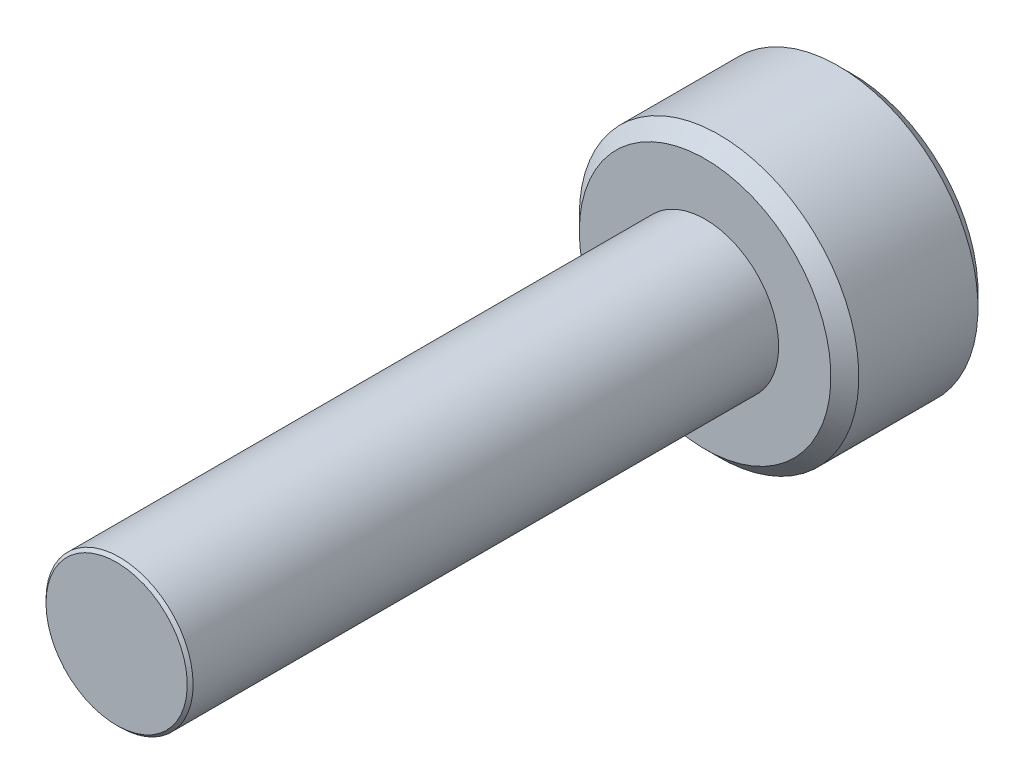
from build123d import *

# Parameters (mm, degrees)
SKETCH1_R            = 1
EXTRUDE1_DEPTH       = 8
CUT_SWEEP1_PITCH     = 0.4
SKETCH6_R            = 1.9
EXTRUDE2_DEPTH       = 2
CUT_EXTRUDE1_DEPTH   = 1.125
CHAMFER1_SIZE        = 0.19
SKETCH10_R           = 1
PARTIAL_THREAD_DEPTH = 8
CHAMFER2_SIZE        = 0.04


with BuildPart() as part:
    # Sketch1 → Extrude1 (new body)
    with BuildSketch(Plane.XY):
        Circle(SKETCH1_R)
    extrude(amount=-EXTRUDE1_DEPTH)

    # Cut-Sweep1: the profile of Sketch3 profile screwed along a right-hand helix of 21 turns, 6 arcs to a turn; built about Z, then put on its axis
    cut_sweep1_z = Axis((0, 0, 0), (0, 0, 1))
    cut_sweep1_corners = [(1.0003, 0, -0.350173205), (0.740192379, 0, -0.2), (0.740192379, 0, -0.15), (1.0003, 0, 0.000173205)]
    with BuildLine(mode=Mode.PRIVATE) as cut_sweep1_profile:
        Line(cut_sweep1_corners[0], cut_sweep1_corners[1])
        Line(cut_sweep1_corners[1], cut_sweep1_corners[2])
        Line(cut_sweep1_corners[2], cut_sweep1_corners[3])
        Line(cut_sweep1_corners[3], cut_sweep1_corners[0])
    cut_sweep1_cap = Face(cut_sweep1_profile.wire())
    cut_sweep1_turn_angles = [0, 30, 60, 90, 120, 150, 180, 210, 240, 270, 300, 330, 360]
    cut_sweep1_turn_weights = [1, 0.8660254037844387, 1, 0.8660254037844387, 1, 0.8660254037844387, 1, 0.8660254037844387, 1, 0.8660254037844387, 1, 0.8660254037844387, 1]
    cut_sweep1_turn_rails = [Edge.make_bspline([Vector(p[0], p[1], 0).rotate(cut_sweep1_z, cut_sweep1_turn_angles[k]) / cut_sweep1_turn_weights[k] + Vector(0, 0, p[2] + CUT_SWEEP1_PITCH * cut_sweep1_turn_angles[k] / 360) for k in range(13)], [0, 0, 0, 1, 1, 2, 2, 3, 3, 4, 4, 5, 5, 6, 6, 6], 2, cut_sweep1_turn_weights) for p in cut_sweep1_corners]
    cut_sweep1_turn_sides = [Face.make_surface_from_curves(cut_sweep1_turn_rails[p[0]], cut_sweep1_turn_rails[p[1]]) for p in [(0, 1), (1, 2), (2, 3), (3, 0)]]
    cut_sweep1 = Plane(origin=(0, 0, 0), x_dir=(0, 1, 0), z_dir=(0, 0, -1)) * Solid(Shell([*[p.moved(Location((0, 0, CUT_SWEEP1_PITCH * i))) for i in range(21) for p in cut_sweep1_turn_sides], cut_sweep1_cap, cut_sweep1_cap.rotate(cut_sweep1_z, 7560).moved(Location((0, 0, CUT_SWEEP1_PITCH * 7560 / 360)))]))
    add(cut_sweep1, mode=Mode.SUBTRACT)

    # Sketch4 → Cut-Revolve1 (revolve, cut)
    with BuildSketch(Plane(origin=(0, 0, 0), x_dir=(0, 0, -1), z_dir=(1, 0, 0)), mode=Mode.PRIVATE) as cut_revolve1_sk:
        Polygon((0.35977197, 1), (0, 0.486192379), (0, 1), align=None)
    revolve(cut_revolve1_sk.sketch.rotate(Axis((0, 0, 0), (0, 0, -1)), 278.428757719), axis=Axis((0, 0, 0), (0, 0, -1)), mode=Mode.SUBTRACT)

    # Sketch6 → Extrude2 (add)
    with BuildSketch(Plane(origin=(0, 0, -8), x_dir=(-1, 0, 0), z_dir=(0, 0, -1))):
        Circle(SKETCH6_R)
    extrude(amount=EXTRUDE2_DEPTH)

    # Sketch7 → Cut-Extrude1 (cut)
    with BuildSketch(Plane(origin=(0, 0, -10), x_dir=(-1, 0, 0), z_dir=(0, 0, -1))):
        Polygon((0, 0.866025404), (-0.75, 0.433012702), (-0.75, -0.433012702), (0, -0.866025404), (0.75, -0.433012702), (0.75, 0.433012702), align=None)
    extrude(amount=-CUT_EXTRUDE1_DEPTH, mode=Mode.SUBTRACT)

    # Cut-Extrude2 cone 1 section (through the dimple's axis) → Cut-Extrude2 (revolve, cut)
    with BuildSketch(Plane(origin=(0, 0, -10), x_dir=(0, 1, 0), z_dir=(1, 0, 0))):
        Polygon((0, 0), (0.866025404, 0), (0, 0.866025404), align=None)
    revolve(axis=Axis((0, 0, -10), (0, 0, 1)), mode=Mode.SUBTRACT)

    # Chamfer1
    chamfer1_edges = [part.edges().sort_by_distance(p)[0] for p in [
        (1.9, 0, -8),
        (1.9, 0, -10),
    ]]
    chamfer(chamfer1_edges, length=CHAMFER1_SIZE)


with BuildPart() as body_2:
    # Sketch10 → partial thread (new body)
    with BuildSketch(Plane.XY.offset(-8)):
        Circle(SKETCH10_R)
    extrude(amount=PARTIAL_THREAD_DEPTH)

    # Chamfer2
    chamfer2_edges = [body_2.edges().sort_by_distance(p)[0] for p in [
        (-1, 0, 0),
    ]]
    chamfer(chamfer2_edges, length=CHAMFER2_SIZE)


with BuildPart() as part_1:
    add(part.part)

    # Combine1: union body 2
    add(body_2.part)


solid = part_1.part
